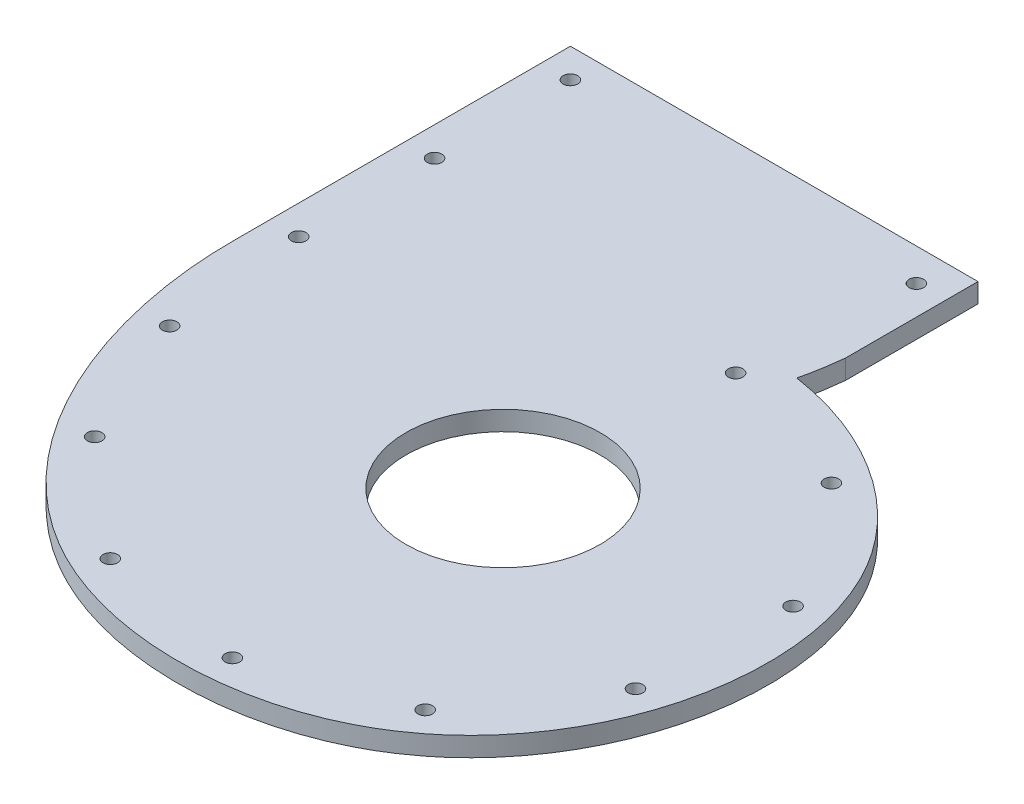
from build123d import *

# Parameters (mm, degrees)
BOSS_EXTRUDE1_DEPTH   = 6.35
FILLET1_R             = 2.54
FILLET2_R             = 0.79375
SKETCH4_R             = 2.38125
CUT_EXTRUDE3_DEPTH    = 6.35
CRVPATTERN1_OUTLINE_R = 2.38125
CRVPATTERN1_DEPTH     = 6.35
SKETCH5_R             = 31.75
BOSS_EXTRUDE2_DEPTH   = 6.35


# Read off the part's stored shape, not the designer's step: CrvPattern1
with BuildPart() as part:
    # Sketch1 → Boss-Extrude1 (new body)
    with BuildSketch(Plane(origin=(0, 0, 0), x_dir=(1, 0, 0), z_dir=(0, 1, 0))):
        with BuildLine():
            Line((0, 136.334024978), (0, 94.083801247))
            add(Edge.make_bspline(
                [(0, 94.083801247), (-2.431386336, 71.693275709), (-15.75825593, 58.230430146)],
                knots=[0, 0, 0, 1, 1, 1], degree=2))
            add(Edge.make_bspline(
                [(-15.75825593, 58.230430146), (12.928997408, 67.764135595), (70.60122301, 46.247103047), (77.540383798, -26.213493844), (40.518788725, -85.775261158), (-67.055108572, -88.304279922), (-95.415707681, -10.214485927), (-95.25, 26.030170649)],
                knots=[0, 0, 0, 0, 0.227546357, 0.356849793, 0.49581236, 0.710996888, 1, 1, 1, 1], degree=3))
            Line((-95.25, 26.030170649), (-95.25, 136.334024978))
            Line((-95.25, 136.334024978), (-114.3, 136.334024978))
            Line((-114.3, 136.334024978), (-114.3, 26.072111228))
            add(Edge.make_bspline(
                [(16.715986391, 79.348568009), (21.633097871, 78.62719896), (31.371857261, 76.389721894), (45.249200497, 70.845276961), (58.14270202, 63.202354702), (69.694268499, 53.486594004), (77.831645881, 43.678743898), (83.1663553, 34.778326042), (87.500656656, 25.500338712), (91.157064432, 13.400044888), (92.998924079, -1.463666218), (92.533158628, -16.332160856), (89.911348046, -30.922868008), (85.224669703, -44.926534482), (78.5424766, -58.087321563), (69.892966554, -70.128088223), (59.334225085, -80.722518946), (46.808294676, -89.48437896), (33.165750854, -95.831204537), (18.8220758, -100.00043745), (4.083822861, -102.101602424), (-10.777441223, -102.219799961), (-25.504851136, -100.381408636), (-37.452741503, -97.197322494), (-46.66563909, -93.622653994), (-53.378233983, -90.404269128), (-59.778019163, -86.667831837), (-67.772964247, -81.11349497), (-76.794838317, -73.191996697), (-86.082507199, -62.480245978), (-96.526865188, -46.978935087), (-104.24741081, -30.151640125), (-109.53383183, -12.800694626), (-112.324631517, 0.306051107), (-113.698273493, 11.158780223), (-114.231429958, 19.740893087), (-114.308990648, 23.9549561), (-114.3, 26.072111228)],
                knots=[0.074418032, 0.074418032, 0.074418032, 0.074418032, 0.103339233, 0.132260434, 0.161181635, 0.190102836, 0.219024037, 0.233484638, 0.247945239, 0.27686644, 0.305787641, 0.334708842, 0.363630043, 0.392551244, 0.421472445, 0.450393647, 0.479314848, 0.508236049, 0.53715725, 0.566078451, 0.594999652, 0.623920853, 0.652842055, 0.681763256, 0.696223856, 0.710684457, 0.725145057, 0.739605658, 0.768526859, 0.79744806, 0.826369261, 0.884211664, 0.913132865, 0.942054066, 0.970975267, 0.985435868, 0.999896468, 0.999896468, 0.999896468, 0.999896468], degree=3))
            add(Edge.make_bspline(
                [(19.05, 93.052513121), (19.023571763, 92.809136693), (18.983692868, 92.443089224), (18.931467162, 91.958957236), (18.862360798, 91.337915751), (18.776292871, 90.610780885), (18.625902721, 89.42512839), (18.420122868, 87.959858448), (18.049990563, 85.627575808), (17.510143571, 82.743597147), (16.996105499, 80.478464636), (16.715986391, 79.348568009)],
                knots=[-0.022894974, -0.022894974, -0.022894974, -0.022894974, -0.006590549, 0.001561663, 0.009713876, 0.0260183, 0.042322725, 0.074931575, 0.107540425, 0.172758125, 0.237975825, 0.237975825, 0.237975825, 0.237975825], degree=3))
            Line((19.05, 93.052513121), (19.05, 136.334024978))
            Line((19.05, 136.334024978), (0, 136.334024978))
        make_face()
    extrude(amount=BOSS_EXTRUDE1_DEPTH)

    # Fillet1
    fillet1_edges = [part.edges().sort_by_distance(p)[0] for p in [
        (0, 3.175, -94.083801247),
        (-95.25, 3.175, -26.030170649),
    ]]
    fillet(fillet1_edges, radius=FILLET1_R)

    # Fillet2
    fillet2_edges = [part.edges().sort_by_distance(p)[0] for p in [
        (-15.75825593, 3.175, -58.230430146),
    ]]
    fillet(fillet2_edges, radius=FILLET2_R)

    # Sketch4 → Cut-Extrude3 (cut)
    with BuildSketch(Plane(origin=(0, 6.35, 0), x_dir=(1, 0, 0), z_dir=(0, 1, 0))):
        with Locations(Location((-104.775, 126.809024978, 0), (0, 0, 270))):
            Circle(SKETCH4_R)
    extrude(amount=-CUT_EXTRUDE3_DEPTH, mode=Mode.SUBTRACT)

    # CrvPattern1 outline → CrvPattern1 (cut)
    with BuildSketch(Plane(origin=(0, 0, 0), x_dir=(1, 0, 0), z_dir=(0, 1, 0))):
        with Locations((-104.775, 82.359024978)):
            Circle(CRVPATTERN1_OUTLINE_R)
        with Locations((-104.775, 37.909024978)):
            Circle(CRVPATTERN1_OUTLINE_R)
        with Locations((-100.597903535, -8.486356178)):
            Circle(CRVPATTERN1_OUTLINE_R)
        with Locations((-81.474554, -52.141471765)):
            Circle(CRVPATTERN1_OUTLINE_R)
        with Locations((-44.376132313, -84.112983027)):
            Circle(CRVPATTERN1_OUTLINE_R)
        with Locations((3.698987105, -92.246074321)):
            Circle(CRVPATTERN1_OUTLINE_R)
        with Locations((49.97064989, -75.450636534)):
            Circle(CRVPATTERN1_OUTLINE_R)
        with Locations((78.388040736, -35.058632959)):
            Circle(CRVPATTERN1_OUTLINE_R)
        with Locations((80.782414242, 14.106535639)):
            Circle(CRVPATTERN1_OUTLINE_R)
        with Locations((52.182738061, 55.247486043)):
            Circle(CRVPATTERN1_OUTLINE_R)
        with Locations((5.302146984, 70.7696737)):
            Circle(CRVPATTERN1_OUTLINE_R)
        with Locations((9.525, 125.703541591)):
            Circle(CRVPATTERN1_OUTLINE_R)
    extrude(amount=CRVPATTERN1_DEPTH, mode=Mode.SUBTRACT)

    # Sketch5 → Boss-Extrude2 (add)
    with BuildSketch(Plane(origin=(0, 6.35, 0), x_dir=(1, 0, 0), z_dir=(0, 1, 0))):
        with BuildLine():
            Line((0, 94.222341016), (0, 136.334024978))
            Line((0, 136.334024978), (-95.25, 136.334024978))
            Line((-95.25, 136.334024978), (-95.25, 26.035946481))
            Line((-95.25, 26.035946481), (-95.250025994, 26.02445519))
            add(Edge.make_bspline(
                [(-95.250025994, 26.02445519), (-95.413998653, -10.219191455), (-67.052567731, -88.304220188), (40.518788725, -85.775261158), (77.540383798, -26.213493844), (70.704250586, 45.171261183), (15.28602209, 66.863348491), (-12.949636793, 59.083069401)],
                knots=[1.5191e-05, 1.5191e-05, 1.5191e-05, 1.5191e-05, 0.289003112, 0.50418764, 0.643150207, 0.772453643, 0.992638541, 0.992638541, 0.992638541, 0.992638541], degree=3))
            ThreePointArc((-12.949636793, 59.083069401), (-13.833627454, 59.427668219), (-13.755858665, 60.373257902))
            add(Edge.make_bspline(
                [(-13.755858665, 60.373257902), (-2.2817326, 73.386271149), (-0.015296893, 93.943999106)],
                knots=[0, 0, 0, 1, 1, 1], degree=2))
            ThreePointArc((-0.015296893, 93.943999106), (-0.003827106, 94.082960051), (0, 94.222341016))
        make_face()
        with Locations(Location((0, 0, 0), (0, 0, 270))):
            Circle(SKETCH5_R, mode=Mode.SUBTRACT)
    extrude(amount=-BOSS_EXTRUDE2_DEPTH)


solid = part.part
